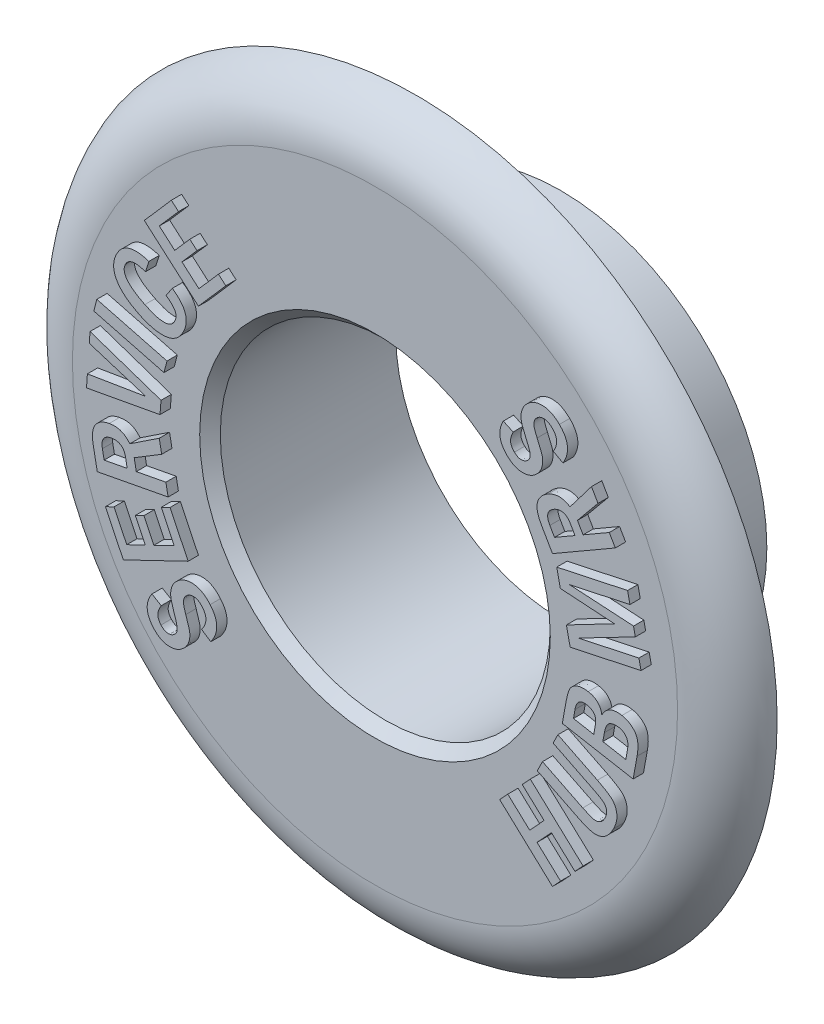
from build123d import *

# Parameters (mm, degrees)
ESQUISSE1_R        = 10
ESQUISSE1_R_2      = 8
BOSS_EXTRU_1_DEPTH = 7
ESQUISSE2_R        = 17.5
ESQUISSE2_R_2      = 8
BOSS_EXTRU_2_DEPTH = 2
CONG_1_R           = 3
CHANFREIN1_SIZE    = 0.5
BOSS_EXTRU_3_DEPTH = 0.5


with BuildPart() as part:
    # Esquisse1 → Boss.-Extru.1 (new body)
    with BuildSketch(Plane.XY):
        Circle(ESQUISSE1_R)
        Circle(ESQUISSE1_R_2, mode=Mode.SUBTRACT)
    extrude(amount=BOSS_EXTRU_1_DEPTH)

    # Esquisse2 → Boss.-Extru.2 (add)
    with BuildSketch(Plane.XY.offset(7)):
        Circle(ESQUISSE2_R)
        Circle(ESQUISSE2_R_2, mode=Mode.SUBTRACT)
    extrude(amount=BOSS_EXTRU_2_DEPTH)

    # Congé1
    # the kernel refuses this fillet: 3 mm, written as the material it takes off along each edge
    with BuildSketch(Plane(origin=(0, 0, 9), x_dir=(1, 0, 0), z_dir=(0, -1, 0))) as cong_1_piece_1:
        with BuildLine():
            CenterArc((14.671572875, -3), CONG_1_R, 19.471220634, 70.528779366)
            Line((14.671572875, 0), (14.671572875, 0.06))
            Line((14.671572875, 0.06), (17.5, 0.06))
            Line((17.5, 0.06), (17.56, 0))
            ThreePointArc((17.56, 0), (17.56, -1), (17.556568542, -1.98))
            Line((17.556568542, -1.98), (17.5, -2))
        make_face()
    revolve(axis=Axis((0, 0, 9), (0, 0, 1)), mode=Mode.SUBTRACT)

    # Chanfrein1
    chanfrein1_edges = [part.edges().sort_by_distance(p)[0] for p in [
        (-8, 0, 9),
    ]]
    chamfer(chanfrein1_edges, length=CHANFREIN1_SIZE)

    # Esquisse3 → Boss.-Extru.3 (add)
    # profile 1 of 13: a face of its own
    with BuildSketch(Plane.XY.offset(9)):
        Polygon((-10.68446492, 8.147242191), (-9.374243566, 9.650388892), (-9.026370302, 9.347328996), (-9.958336448, 8.278644101), (-9.208661969, 7.624672746), (-8.477976205, 8.462454864), (-8.127824295, 8.157116323), (-8.858510059, 7.319334205), (-8.037438011, 6.603079864), (-7.089521344, 7.689234378), (-6.734052594, 7.379338545), (-8.060224469, 5.858722226), align=None)
    # profile 2 of 13: a face of its own
    with BuildSketch(Plane.XY.offset(9)):
        with BuildLine():
            Line((-9.629167081, 5.527917033), (-9.327626283, 5.973772068))
            add(Edge.make_bspline(
                [(-9.327626283, 5.973772068), (-9.288523151, 5.946412466), (-9.212247057, 5.89304376), (-9.107112651, 5.807054021), (-9.011973374, 5.720329142), (-8.928285511, 5.631574205), (-8.855470707, 5.540730464), (-8.793890013, 5.44824142), (-8.742978381, 5.353996308), (-8.703537218, 5.257978965), (-8.673680199, 5.160228846), (-8.657805151, 5.060066664), (-8.65033756, 4.958597019), (-8.655158448, 4.855396274), (-8.671523419, 4.75090668), (-8.698381765, 4.644612685), (-8.736398456, 4.536602557), (-8.769261427, 4.465812838), (-8.786068123, 4.429609741)],
                knots=[0, 0, 0, 0, 1.25831485, 2.45451805, 3.579291553, 4.651643519, 5.668437617, 6.646312129, 7.578428866, 8.488641703, 9.380244482, 10.267259418, 11.157410686, 12.059775972, 12.985291658, 13.942449899, 14.947733, 16, 16, 16, 16], degree=3))
            add(Edge.make_bspline(
                [(-8.786068123, 4.429609741), (-8.81018458, 4.383990006), (-8.857164132, 4.295121447), (-8.941744596, 4.17424993), (-9.036572059, 4.070271564), (-9.140141608, 3.981492211), (-9.253338153, 3.90889875), (-9.375881609, 3.851979466), (-9.508024686, 3.81283806), (-9.647996102, 3.788642515), (-9.794917323, 3.780390366), (-9.9472984, 3.7844226), (-10.104714086, 3.80072544), (-10.266500887, 3.833417166), (-10.433894746, 3.875891862), (-10.605605251, 3.934902249), (-10.782820552, 4.005059515), (-10.900444854, 4.060799242), (-10.960655796, 4.089331964)],
                knots=[0, 0, 0, 0, 0.995387172, 1.939042868, 2.838471923, 3.705148016, 4.564615462, 5.426122934, 6.304269616, 7.216983654, 8.162005062, 9.139719801, 10.157035791, 11.212287137, 12.322937725, 13.488188407, 14.714223669, 16, 16, 16, 16], degree=3))
            add(Edge.make_bspline(
                [(-10.960655796, 4.089331964), (-11.024625405, 4.121729481), (-11.148771362, 4.184603414), (-11.322823813, 4.288936283), (-11.482513303, 4.394292836), (-11.624351326, 4.505474254), (-11.7511753, 4.619037692), (-11.861491547, 4.736510345), (-11.955839706, 4.857932349), (-12.033877365, 4.982722027), (-12.094992332, 5.110343035), (-12.138855826, 5.240145813), (-12.166254265, 5.371734131), (-12.174081114, 5.505409196), (-12.165597993, 5.64032507), (-12.140213385, 5.776841018), (-12.096589977, 5.914884746), (-12.055637119, 6.004551454), (-12.034657533, 6.050486477)],
                knots=[0, 0, 0, 0, 1.36088723, 2.641076774, 3.850211054, 4.990550643, 6.0591517, 7.079351571, 8.04558552, 8.973893925, 9.868283002, 10.725557099, 11.569234989, 12.412049838, 13.259661871, 14.12981556, 15.041930203, 16, 16, 16, 16], degree=3))
            add(Edge.make_bspline(
                [(-12.034657533, 6.050486477), (-12.01652265, 6.085263021), (-11.981137638, 6.153119455), (-11.918996908, 6.247158573), (-11.85151828, 6.331725909), (-11.778308094, 6.406645257), (-11.699608943, 6.471925409), (-11.614881406, 6.526813123), (-11.524337953, 6.571833383), (-11.428542262, 6.607954947), (-11.326671475, 6.632474705), (-11.219692835, 6.64879245), (-11.107049122, 6.654182251), (-10.988647643, 6.651516802), (-10.864875715, 6.636983963), (-10.735461796, 6.614242785), (-10.600506815, 6.581420565), (-10.509833527, 6.552834093), (-10.463151456, 6.538116686)],
                knots=[0, 0, 0, 0, 1.02887218, 2.007548468, 2.952992882, 3.864623913, 4.752053024, 5.631258426, 6.507948933, 7.401601169, 8.312214402, 9.252953045, 10.237881195, 11.268233043, 12.357988157, 13.505130795, 14.715546058, 16, 16, 16, 16], degree=3))
            Line((-10.463151456, 6.538116686), (-10.628733053, 6.020104533))
            add(Edge.make_bspline(
                [(-10.628733053, 6.020104533), (-10.659284304, 6.03073682), (-10.718742162, 6.051429033), (-10.806615965, 6.077366329), (-10.89059078, 6.097112446), (-10.97037151, 6.112045558), (-11.046299705, 6.12017085), (-11.117876374, 6.123762672), (-11.185223932, 6.120599536), (-11.248527079, 6.112348989), (-11.307993987, 6.098984017), (-11.363248167, 6.079315092), (-11.413439469, 6.05283468), (-11.460879665, 6.022610163), (-11.502895401, 5.985089734), (-11.541526442, 5.94273923), (-11.576123915, 5.894759269), (-11.594564513, 5.859089535), (-11.60399347, 5.840851061)],
                knots=[0, 0, 0, 0, 1.413799054, 2.751490137, 4.002320606, 5.183148462, 6.296449753, 7.337619889, 8.312456566, 9.238987682, 10.124841889, 10.971971393, 11.793562264, 12.600792888, 13.424244837, 14.246803994, 15.103564363, 16, 16, 16, 16], degree=3))
            add(Edge.make_bspline(
                [(-11.60399347, 5.840851061), (-11.615174608, 5.816079379), (-11.637111522, 5.767478402), (-11.655803847, 5.690905822), (-11.663107717, 5.614325479), (-11.657428003, 5.537974141), (-11.64041178, 5.461436327), (-11.611004664, 5.385097142), (-11.56960988, 5.308814069), (-11.515353809, 5.233214837), (-11.449787203, 5.157470957), (-11.372597091, 5.081285228), (-11.283002271, 5.005218028), (-11.181591009, 4.929215913), (-11.068422054, 4.852676526), (-10.942679842, 4.77732874), (-10.805745366, 4.700369443), (-10.708955482, 4.651999665), (-10.659114998, 4.62709238)],
                knots=[0, 0, 0, 0, 0.762739505, 1.496462176, 2.204065549, 2.917622913, 3.639510571, 4.400986876, 5.209955146, 6.073014985, 7.011856248, 8.023561265, 9.119133035, 10.313562916, 11.58498584, 12.958347195, 14.433746976, 16, 16, 16, 16], degree=3))
            add(Edge.make_bspline(
                [(-10.659114998, 4.62709238), (-10.612152376, 4.604789843), (-10.52113503, 4.561565728), (-10.386967021, 4.503360182), (-10.258935918, 4.455786848), (-10.138201985, 4.415335725), (-10.023635328, 4.385934168), (-9.915894253, 4.364839714), (-9.814793259, 4.353085173), (-9.720250628, 4.35084177), (-9.632254647, 4.356029984), (-9.550911717, 4.372301282), (-9.476025688, 4.396912023), (-9.40814468, 4.431844591), (-9.346433462, 4.475279497), (-9.29263992, 4.529257152), (-9.244493259, 4.59125456), (-9.219603038, 4.6380633), (-9.206858053, 4.662031616)],
                knots=[0, 0, 0, 0, 1.53911643, 2.98293173, 4.32778885, 5.58167492, 6.750622574, 7.826677445, 8.829887108, 9.75958998, 10.623645347, 11.433600667, 12.208678301, 12.949511569, 13.685780671, 14.433107302, 15.197675913, 16, 16, 16, 16], degree=3))
            add(Edge.make_bspline(
                [(-9.206858053, 4.662031616), (-9.197875835, 4.681879427), (-9.180438706, 4.720409868), (-9.16110149, 4.779360296), (-9.149506607, 4.837497929), (-9.145528884, 4.894712099), (-9.149521356, 4.950607241), (-9.160150064, 5.005307331), (-9.17846353, 5.058776824), (-9.214886129, 5.129861082), (-9.276884659, 5.218549592), (-9.372458475, 5.322651747), (-9.491234603, 5.427701806), (-9.581463575, 5.493257917), (-9.629167081, 5.527917033)],
                knots=[0, 0, 0, 0, 0.734552614, 1.425982771, 2.087600162, 2.729576946, 3.354511132, 3.972579313, 4.604593488, 5.253913844, 6.661062636, 8.239250348, 10.011714634, 12, 12, 12, 12], degree=3))
        make_face()
    # profile 3 of 13: a face of its own
    with BuildSketch(Plane.XY.offset(9)):
        Polygon((-13.133591563, 3.119179753), (-12.986998681, 3.682005274), (-9.584980452, 2.795612045), (-9.731573334, 2.232786524), align=None)
    # profile 4 of 13: a face of its own
    with BuildSketch(Plane.XY.offset(9)):
        Polygon((-13.487774917, -0.285368175), (-13.445240195, 0.32454936), (-10.607566584, 0.793190853), (-13.351815715, 1.655278526), (-13.316116931, 2.167973839), (-9.873842625, 0.999788075), (-9.925491931, 0.372400922), align=None)
    # profile 5 of 13: a face of its own
    with BuildSketch(Plane.XY.offset(9)):
        with BuildLine():
            Line((-12.965405852, -3.544240459), (-13.162128942, -2.5104948))
            add(Edge.make_bspline(
                [(-13.162128942, -2.5104948), (-13.17008957, -2.465013184), (-13.185462186, -2.377184512), (-13.197760614, -2.247949754), (-13.200024323, -2.12660272), (-13.194061619, -2.012602975), (-13.17631, -1.906555741), (-13.149844896, -1.807998756), (-13.114405164, -1.716492165), (-13.067588988, -1.633276534), (-13.011540857, -1.557876991), (-12.948086226, -1.488619313), (-12.875503261, -1.426717498), (-12.793638717, -1.373147109), (-12.704194849, -1.325678323), (-12.606213687, -1.285525798), (-12.499834641, -1.251767873), (-12.425028715, -1.236310979), (-12.38662981, -1.228376744)],
                knots=[0, 0, 0, 0, 1.290793418, 2.49262631, 3.625590054, 4.682399745, 5.679870009, 6.626179873, 7.532004329, 8.416325126, 9.287166724, 10.153941036, 11.037808278, 11.946946737, 12.8843961, 13.865220213, 14.904188337, 16, 16, 16, 16], degree=3))
            add(Edge.make_bspline(
                [(-12.38662981, -1.228376744), (-12.335364083, -1.22026901), (-12.236027982, -1.204558892), (-12.088933948, -1.202537929), (-11.950051897, -1.217857883), (-11.819456852, -1.252807835), (-11.697879044, -1.307937076), (-11.58437868, -1.380582285), (-11.479849702, -1.47305104), (-11.419542924, -1.545759331), (-11.388582935, -1.583085945)],
                knots=[0, 0, 0, 0, 1.10925397, 2.149368998, 3.136351053, 4.090288788, 5.028550404, 5.981149299, 6.963572659, 8, 8, 8, 8], degree=3))
            Line((-11.388582935, -1.583085945), (-9.960631547, -0.635169279))
            Line((-9.960631547, -0.635169279), (-9.842901512, -1.251922751))
            Line((-9.842901512, -1.251922751), (-11.174390227, -2.060842022))
            Line((-11.174390227, -2.060842022), (-11.073370262, -2.594045147))
            Line((-11.073370262, -2.594045147), (-9.639342484, -2.320607647))
            Line((-9.639342484, -2.320607647), (-9.530727033, -2.889509557))
            Line((-9.530727033, -2.889509557), (-12.965405852, -3.544240459))
        make_face()
        with BuildLine():
            Line((-12.633483109, -2.891028654), (-11.513908456, -2.677595494))
            Line((-11.513908456, -2.677595494), (-11.596699255, -2.24237414))
            add(Edge.make_bspline(
                [(-11.596699255, -2.24237414), (-11.60168705, -2.219003108), (-11.611373057, -2.173617924), (-11.630882925, -2.108868857), (-11.655294572, -2.050216025), (-11.683432073, -1.997047911), (-11.716129362, -1.949943556), (-11.752724351, -1.90818378), (-11.794288414, -1.873190408), (-11.854086854, -1.833608608), (-11.937611993, -1.797561564), (-12.046234501, -1.77311482), (-12.164176856, -1.768518469), (-12.243955168, -1.780926114), (-12.285609845, -1.787404522)],
                knots=[0, 0, 0, 0, 0.914520806, 1.775946179, 2.584041781, 3.342806041, 4.074024624, 4.774208137, 5.461667363, 6.147074263, 7.513839802, 8.915044919, 10.389251365, 12, 12, 12, 12], degree=3))
            add(Edge.make_bspline(
                [(-12.285609845, -1.787404522), (-12.30720935, -1.791885773), (-12.349284331, -1.800615074), (-12.409298565, -1.818800401), (-12.464099077, -1.840876791), (-12.514077707, -1.866013391), (-12.559154408, -1.894722795), (-12.598946, -1.927856423), (-12.634135785, -1.963922386), (-12.663088889, -2.004581586), (-12.68882559, -2.047515902), (-12.707199177, -2.095255634), (-12.722152535, -2.14570938), (-12.73078397, -2.200070364), (-12.735515075, -2.257975203), (-12.734525427, -2.319487234), (-12.728254543, -2.384434041), (-12.720853602, -2.428502949), (-12.717033456, -2.451250008)],
                knots=[0, 0, 0, 0, 1.165356172, 2.270067758, 3.308625834, 4.283981557, 5.222959475, 6.125779299, 7.015315027, 7.877045866, 8.758291616, 9.652744439, 10.571680299, 11.535124667, 12.555159645, 13.639012621, 14.78132856, 16, 16, 16, 16], degree=3))
            Line((-12.717033456, -2.451250008), (-12.633483109, -2.891028654))
        make_face(mode=Mode.SUBTRACT)
    # profile 6 of 13: a face of its own
    with BuildSketch(Plane.XY.offset(9)):
        Polygon((-11.702584446, -6.614832221), (-12.569229411, -4.813942464), (-12.152237224, -4.613421631), (-11.5362433, -5.894020589), (-10.638456842, -5.46183743), (-11.121529758, -4.457714166), (-10.702258925, -4.255674235), (-10.219186008, -5.259797499), (-9.236330106, -4.786598714), (-9.862198161, -3.485491943), (-9.43609139, -3.280413818), (-8.559572293, -5.101811388), align=None)
    # profile 7 of 13: a face of its own
    with BuildSketch(Plane.XY.offset(9)):
        with BuildLine():
            Line((-10.314825514, -7.352409652), (-9.864413188, -7.618251666))
            add(Edge.make_bspline(
                [(-9.864413188, -7.618251666), (-9.887816073, -7.657535695), (-9.932180437, -7.732005612), (-9.98211838, -7.845457071), (-10.015106839, -7.952158308), (-10.030326203, -8.054042303), (-10.024278486, -8.153295863), (-9.995873138, -8.250434551), (-9.945800643, -8.346320416), (-9.899882194, -8.404842111), (-9.875806417, -8.435525972)],
                knots=[0, 0, 0, 0, 1.232774222, 2.336944519, 3.335370675, 4.238619663, 5.101039672, 5.996167596, 6.949358623, 8, 8, 8, 8], degree=3))
            add(Edge.make_bspline(
                [(-9.875806417, -8.435525972), (-9.851422806, -8.461870093), (-9.804848098, -8.512189534), (-9.722775909, -8.568669112), (-9.636474502, -8.60539575), (-9.546890271, -8.61921404), (-9.458986529, -8.615303045), (-9.375733095, -8.59597163), (-9.297762077, -8.562869341), (-9.253354714, -8.528713599), (-9.230949646, -8.511480833)],
                knots=[0, 0, 0, 0, 1.183094996, 2.259808946, 3.264987231, 4.256601532, 5.227929008, 6.15532004, 7.069294426, 8, 8, 8, 8], degree=3))
            add(Edge.make_bspline(
                [(-9.230949646, -8.511480833), (-9.20857995, -8.490658342), (-9.165242752, -8.450318572), (-9.119788487, -8.375284532), (-9.092645751, -8.293731407), (-9.088068083, -8.220297168), (-9.092349629, -8.156334771), (-9.10023612, -8.100042488), (-9.112597308, -8.036215466), (-9.129334223, -7.965019173), (-9.151010506, -7.886354094), (-9.176646486, -7.800190078), (-9.207228603, -7.706549085), (-9.229814254, -7.642008665), (-9.241583327, -7.608377534)],
                knots=[0, 0, 0, 0, 1.132970691, 2.194923599, 3.226112079, 4.303839073, 4.908178949, 5.611925179, 6.417809656, 7.327644688, 8.333588555, 9.454738265, 10.673698924, 12, 12, 12, 12], degree=3))
            add(Edge.make_bspline(
                [(-9.241583327, -7.608377534), (-9.261397566, -7.551594778), (-9.298849392, -7.444267017), (-9.34324679, -7.289326809), (-9.378372114, -7.151839301), (-9.40114553, -7.027840982), (-9.410306258, -6.911728672), (-9.40493781, -6.798444242), (-9.385372944, -6.685337001), (-9.353087411, -6.573087079), (-9.305663894, -6.463352024), (-9.240275023, -6.360207354), (-9.161496475, -6.261650147), (-9.097892162, -6.204389552), (-9.065368049, -6.175109305)],
                knots=[0, 0, 0, 0, 1.388615614, 2.624687759, 3.720901215, 4.664891461, 5.532645414, 6.404820446, 7.276681831, 8.177833469, 9.096866396, 10.026551273, 10.990875536, 12, 12, 12, 12], degree=3))
            add(Edge.make_bspline(
                [(-9.065368049, -6.175109305), (-9.037451177, -6.152479592), (-8.982283285, -6.107759914), (-8.892800977, -6.051894722), (-8.800797359, -6.004836639), (-8.704984363, -5.96942045), (-8.606784256, -5.942266848), (-8.505113887, -5.926274739), (-8.400290044, -5.921626442), (-8.293181811, -5.924768171), (-8.185128749, -5.939996362), (-8.078574494, -5.967323269), (-7.974470134, -6.007321049), (-7.873022908, -6.059453709), (-7.773628273, -6.123626201), (-7.677548901, -6.20106965), (-7.582577405, -6.28922844), (-7.523952875, -6.355358605), (-7.493861973, -6.389302013)],
                knots=[0, 0, 0, 0, 0.967342925, 1.911613474, 2.835890215, 3.746781221, 4.658489078, 5.576908237, 6.512591293, 7.48176012, 8.459888433, 9.445880936, 10.439019768, 11.457895025, 12.513616084, 13.620411782, 14.778600733, 16, 16, 16, 16], degree=3))
            add(Edge.make_bspline(
                [(-7.493861973, -6.389302013), (-7.468810606, -6.41955996), (-7.419832022, -6.478718065), (-7.356135225, -6.572042635), (-7.300920305, -6.665377035), (-7.255968039, -6.75970882), (-7.220802787, -6.854566372), (-7.194527787, -6.949787607), (-7.178685325, -7.046042068), (-7.17190711, -7.142651825), (-7.173711159, -7.239917915), (-7.187311547, -7.337494605), (-7.209466277, -7.435795423), (-7.24051891, -7.534819655), (-7.282218044, -7.633810995), (-7.332501799, -7.733661739), (-7.392599081, -7.834249752), (-7.438960544, -7.899344284), (-7.46272048, -7.932704791)],
                knots=[0, 0, 0, 0, 1.113883725, 2.177783286, 3.201475387, 4.187797156, 5.137750011, 6.068196147, 6.985688545, 7.900167732, 8.812613736, 9.740060933, 10.68974221, 11.668819236, 12.679910399, 13.73350413, 14.838436184, 16, 16, 16, 16], degree=3))
            Line((-7.46272048, -7.932704791), (-7.907815966, -7.633442638))
            add(Edge.make_bspline(
                [(-7.907815966, -7.633442638), (-7.891933411, -7.612060279), (-7.860893692, -7.570272136), (-7.818507055, -7.506699105), (-7.784252759, -7.442575495), (-7.753509855, -7.380326575), (-7.731254702, -7.317644948), (-7.713269182, -7.256129529), (-7.701925325, -7.1950793), (-7.696131896, -7.134780537), (-7.698188473, -7.075241589), (-7.704689122, -7.016423017), (-7.717920992, -6.958182594), (-7.73693856, -6.900438015), (-7.761962677, -6.84336387), (-7.793809143, -6.78753377), (-7.830777343, -6.731895365), (-7.859646956, -6.69668054), (-7.874395827, -6.678690034)],
                knots=[0, 0, 0, 0, 1.216945066, 2.378309676, 3.486077645, 4.53637461, 5.546344029, 6.520301286, 7.461778301, 8.379143167, 9.281657489, 10.178371626, 11.079179519, 12.004603382, 12.952383183, 13.92083003, 14.937796249, 16, 16, 16, 16], degree=3))
            add(Edge.make_bspline(
                [(-7.874395827, -6.678690034), (-7.889289547, -6.66169564), (-7.918123569, -6.628794742), (-7.965141132, -6.585390035), (-8.011971784, -6.547430596), (-8.059216929, -6.514707159), (-8.108162517, -6.489644892), (-8.157706903, -6.4708751), (-8.207595189, -6.456291881), (-8.274404362, -6.448096872), (-8.356910399, -6.449274215), (-8.452994548, -6.468515254), (-8.543176157, -6.510240632), (-8.596144827, -6.550292707), (-8.623310757, -6.570834131)],
                knots=[0, 0, 0, 0, 0.953603482, 1.846162269, 2.697696338, 3.498312667, 4.268142649, 5.012688264, 5.733759895, 6.456493986, 7.846495211, 9.201013947, 10.564489874, 12, 12, 12, 12], degree=3))
            add(Edge.make_bspline(
                [(-8.623310757, -6.570834131), (-8.642227093, -6.588436584), (-8.679802587, -6.623402176), (-8.723956808, -6.686967659), (-8.757656982, -6.757512736), (-8.778223687, -6.82212742), (-8.78634872, -6.880770979), (-8.786495183, -6.932725147), (-8.781966911, -6.991951931), (-8.770576624, -7.058542415), (-8.754680173, -7.132550253), (-8.733388858, -7.213980756), (-8.705489198, -7.302409415), (-8.684469845, -7.363598133), (-8.673440966, -7.395703923)],
                knots=[0, 0, 0, 0, 1.045037225, 2.07586664, 3.11326597, 4.207396121, 4.808299537, 5.506274967, 6.309172229, 7.213560656, 8.242190775, 9.377334243, 10.623884286, 12, 12, 12, 12], degree=3))
            add(Edge.make_bspline(
                [(-8.673440966, -7.395703923), (-8.661511182, -7.429873016), (-8.638470506, -7.495865751), (-8.605651771, -7.591434738), (-8.576623504, -7.680516528), (-8.551554449, -7.763074097), (-8.530314796, -7.839374959), (-8.511900359, -7.908904337), (-8.497376291, -7.971970267), (-8.482881135, -8.047365792), (-8.472271981, -8.139275482), (-8.477108476, -8.251092331), (-8.494627979, -8.366100545), (-8.526946847, -8.482596142), (-8.574644494, -8.597165987), (-8.637806024, -8.706390496), (-8.719536018, -8.806588717), (-8.783576229, -8.865677655), (-8.816236105, -8.89581243)],
                knots=[0, 0, 0, 0, 1.065855494, 2.058548027, 2.975790485, 3.824954578, 4.599258703, 5.308192774, 5.943071298, 6.504622996, 7.569304222, 8.658557854, 9.790069877, 10.989440537, 12.209401177, 13.435793292, 14.6922799, 16, 16, 16, 16], degree=3))
            add(Edge.make_bspline(
                [(-8.816236105, -8.89581243), (-8.842658339, -8.917382506), (-8.894669673, -8.959842519), (-8.978842374, -9.013153342), (-9.06562799, -9.056220358), (-9.154562823, -9.091423771), (-9.246725144, -9.115218043), (-9.34153454, -9.130836935), (-9.439061314, -9.135949598), (-9.538250482, -9.131263323), (-9.637414363, -9.117319079), (-9.734501814, -9.091685536), (-9.828814124, -9.056950524), (-9.920100645, -9.011450221), (-10.008531444, -8.955892231), (-10.093490084, -8.888934168), (-10.177039283, -8.813416376), (-10.227525394, -8.75583328), (-10.253302077, -8.72643309)],
                knots=[0, 0, 0, 0, 1.008097408, 1.984407887, 2.938792323, 3.87046422, 4.807656473, 5.748163271, 6.708054267, 7.690005311, 8.681191697, 9.663742108, 10.654079609, 11.64865429, 12.67494191, 13.736886648, 14.844522675, 16, 16, 16, 16], degree=3))
            add(Edge.make_bspline(
                [(-10.253302077, -8.72643309), (-10.275196967, -8.699628308), (-10.318159163, -8.647031911), (-10.374887171, -8.564964266), (-10.424363983, -8.482581764), (-10.464212475, -8.398876261), (-10.497519743, -8.315096117), (-10.521889503, -8.230388693), (-10.538052644, -8.14494252), (-10.545376201, -8.05895276), (-10.545653505, -7.972509035), (-10.537047938, -7.885287073), (-10.520283223, -7.797657561), (-10.495628623, -7.709254028), (-10.462817289, -7.620380642), (-10.421722535, -7.530737948), (-10.372046349, -7.440872429), (-10.334171653, -7.382318567), (-10.314825514, -7.352409652)],
                knots=[0, 0, 0, 0, 1.108987317, 2.176057143, 3.194850275, 4.185755594, 5.144227614, 6.081718795, 7.006478461, 7.927098242, 8.844134159, 9.773582296, 10.73174506, 11.70046914, 12.712061313, 13.765183945, 14.858471117, 16, 16, 16, 16], degree=3))
        make_face()
    # profile 8 of 13: a face of its own
    with BuildSketch(Plane.XY.offset(9)):
        with BuildLine():
            Line((9.582545549, -2.839003623), (9.769394508, -1.799941123))
            add(Edge.make_bspline(
                [(9.769394508, -1.799941123), (9.775322491, -1.768263173), (9.786822545, -1.7068092), (9.805977434, -1.617960404), (9.825132764, -1.535166469), (9.847021061, -1.459234437), (9.86767234, -1.388965964), (9.89065745, -1.32523928), (9.913940323, -1.267584739), (9.946034212, -1.199073395), (9.996408205, -1.121895143), (10.075083374, -1.041669705), (10.171265762, -0.973042896), (10.283817588, -0.917454787), (10.409218354, -0.876222448), (10.545323788, -0.855446415), (10.689896362, -0.853642395), (10.787562866, -0.868095046), (10.838079403, -0.875570464)],
                knots=[0, 0, 0, 0, 0.945251826, 1.833751188, 2.665935571, 3.437134741, 4.151302968, 4.813708576, 5.423259351, 5.974664238, 7.031324814, 8.107943656, 9.251821701, 10.480656032, 11.777020425, 13.107833483, 14.504070144, 16, 16, 16, 16], degree=3))
            add(Edge.make_bspline(
                [(10.838079403, -0.875570464), (10.883496131, -0.88520571), (10.970918446, -0.903752524), (11.092335884, -0.950934778), (11.199387301, -1.010563778), (11.290564628, -1.08574418), (11.367258956, -1.174252446), (11.427117628, -1.277548221), (11.473139661, -1.394023378), (11.489597496, -1.477778676), (11.498127146, -1.521186783)],
                knots=[0, 0, 0, 0, 1.119188445, 2.154317361, 3.131474543, 4.065056187, 4.992475773, 5.943185146, 6.934008464, 8, 8, 8, 8], degree=3))
            add(Edge.make_bspline(
                [(11.498127146, -1.521186783), (11.510941804, -1.497683313), (11.536099445, -1.451541474), (11.579085468, -1.38723196), (11.623446525, -1.327217173), (11.672520224, -1.274287468), (11.723437494, -1.226213617), (11.776921842, -1.182969659), (11.833970188, -1.146156756), (11.893346147, -1.11367092), (11.956145054, -1.08798178), (12.02147132, -1.067500411), (12.089796898, -1.05218722), (12.160915917, -1.042276323), (12.234858518, -1.038759657), (12.311477787, -1.040417832), (12.390926358, -1.047074462), (12.444571593, -1.055734299), (12.471868466, -1.060140776)],
                knots=[0, 0, 0, 0, 1.100362842, 2.160224182, 3.178559253, 4.166140734, 5.12373614, 6.05713696, 6.989956837, 7.912374713, 8.836671243, 9.775226613, 10.725034944, 11.713110312, 12.724447902, 13.765889823, 14.863194041, 16, 16, 16, 16], degree=3))
            add(Edge.make_bspline(
                [(12.471868466, -1.060140776), (12.502909626, -1.066374546), (12.564435238, -1.078730287), (12.653043203, -1.107590754), (12.738064308, -1.141356641), (12.818247341, -1.18336679), (12.893248298, -1.233150561), (12.964799784, -1.28858409), (13.03052824, -1.352496546), (13.094025396, -1.42165727), (13.148704759, -1.502464623), (13.192336132, -1.595336454), (13.222659489, -1.700783245), (13.24345871, -1.81786036), (13.250534107, -1.947202756), (13.248394795, -2.088634703), (13.233273622, -2.242104764), (13.216070495, -2.34791783), (13.207111521, -2.40302272)],
                knots=[0, 0, 0, 0, 0.867820331, 1.720076762, 2.551940233, 3.375177085, 4.197710515, 5.018835295, 5.853939655, 6.709867066, 7.590186971, 8.519135842, 9.512328034, 10.591367383, 11.774525608, 13.059562109, 14.468690939, 16, 16, 16, 16], degree=3))
            Line((13.207111521, -2.40302272), (13.017224369, -3.457276193))
            Line((13.017224369, -3.457276193), (9.582545549, -2.839003623))
        make_face()
        with BuildLine():
            Line((11.106959612, -2.53974147), (11.171521244, -2.179715429))
            add(Edge.make_bspline(
                [(11.171521244, -2.179715429), (11.176697742, -2.14938715), (11.186626754, -2.091214657), (11.195069359, -2.006969664), (11.197414839, -1.930068494), (11.194853403, -1.860418137), (11.186130244, -1.797895885), (11.170938348, -1.742801329), (11.150667143, -1.694499267), (11.114503047, -1.640902636), (11.058411516, -1.584693695), (10.978546234, -1.53045792), (10.885229854, -1.490787337), (10.817631815, -1.475785638), (10.782632355, -1.46801838)],
                knots=[0, 0, 0, 0, 1.180910116, 2.265096755, 3.247233192, 4.132592379, 4.938108239, 5.66443435, 6.321728177, 6.939071705, 8.135046123, 9.34550726, 10.625613766, 12, 12, 12, 12], degree=3))
            add(Edge.make_bspline(
                [(10.782632355, -1.46801838), (10.761662767, -1.46463843), (10.721399103, -1.458148595), (10.662158392, -1.454209702), (10.606773949, -1.455857649), (10.554984904, -1.461398014), (10.507088145, -1.47309429), (10.46288898, -1.489381414), (10.422981016, -1.512169991), (10.385987598, -1.53859023), (10.352881861, -1.571450478), (10.322791608, -1.609321539), (10.295284182, -1.652448642), (10.270115375, -1.700716914), (10.247450766, -1.754546233), (10.227947273, -1.813785685), (10.211109748, -1.878256362), (10.202338169, -1.923185895), (10.197779924, -1.946534005)],
                knots=[0, 0, 0, 0, 1.167609834, 2.241925356, 3.258673122, 4.21195478, 5.100074023, 5.963738321, 6.792702101, 7.619793042, 8.456669626, 9.348165554, 10.275053664, 11.265239815, 12.338381862, 13.483105849, 14.692069123, 16, 16, 16, 16], degree=3))
            Line((10.197779924, -1.946534005), (10.12334416, -2.362007095))
            Line((10.12334416, -2.362007095), (11.106959612, -2.53974147))
        make_face(mode=Mode.SUBTRACT)
        with BuildLine():
            Line((12.661755619, -2.819255359), (12.743786869, -2.361247547))
            add(Edge.make_bspline(
                [(12.743786869, -2.361247547), (12.747955559, -2.335721565), (12.756016482, -2.286362423), (12.761694445, -2.21375567), (12.764042887, -2.145209787), (12.759035434, -2.080714161), (12.750413989, -2.020355014), (12.735854888, -1.964321585), (12.716058028, -1.912321935), (12.691088245, -1.864195958), (12.66024077, -1.820443814), (12.62426561, -1.780671764), (12.583185968, -1.745017489), (12.53714992, -1.713497238), (12.485512958, -1.686805087), (12.428624909, -1.664496463), (12.366819374, -1.644970845), (12.323355572, -1.636462835), (12.300970028, -1.63208088)],
                knots=[0, 0, 0, 0, 1.269316076, 2.454454208, 3.573532925, 4.632808939, 5.62613395, 6.563840724, 7.468841299, 8.352939145, 9.218578538, 10.089911819, 10.979845933, 11.88322288, 12.822905162, 13.82706114, 14.88085224, 16, 16, 16, 16], degree=3))
            add(Edge.make_bspline(
                [(12.300970028, -1.63208088), (12.265343935, -1.627303483), (12.195197549, -1.617896975), (12.089089146, -1.62526848), (11.986342372, -1.651066708), (11.90350243, -1.685905167), (11.840220109, -1.725098681), (11.797758024, -1.766933058), (11.757647325, -1.816395766), (11.723152808, -1.876860907), (11.691380445, -1.945968491), (11.663195045, -2.024685785), (11.640095815, -2.113293399), (11.627674032, -2.175846032), (11.621174021, -2.208578276)],
                knots=[0, 0, 0, 0, 1.264406386, 2.489566779, 3.721047904, 4.984162584, 5.642572449, 6.330611678, 7.073412802, 7.881473896, 8.775833638, 9.752462209, 10.823919145, 12, 12, 12, 12], degree=3))
            Line((11.621174021, -2.208578276), (11.547497806, -2.618734526))
            Line((11.547497806, -2.618734526), (12.661755619, -2.819255359))
        make_face(mode=Mode.SUBTRACT)
    # profile 9 of 13: a face of its own
    with BuildSketch(Plane.XY.offset(9)):
        with BuildLine():
            Line((8.369226136, -5.433141747), (8.622155824, -4.924244178))
            Line((8.622155824, -4.924244178), (10.572676657, -5.892668657))
            add(Edge.make_bspline(
                [(10.572676657, -5.892668657), (10.598962699, -5.905673514), (10.64981626, -5.930833), (10.724259041, -5.96579501), (10.793950941, -5.996821037), (10.858691258, -6.024375007), (10.918654938, -6.04812686), (10.974095834, -6.067465982), (11.024132406, -6.084895573), (11.084147816, -6.100760517), (11.155169869, -6.113303661), (11.238829601, -6.111529016), (11.319991174, -6.095489079), (11.39836571, -6.063758283), (11.472989139, -6.016391006), (11.540235686, -5.950422596), (11.602325934, -5.869535321), (11.635447881, -5.80690481), (11.652754782, -5.774179074)],
                knots=[0, 0, 0, 0, 1.11257379, 2.152409961, 3.119856868, 4.006494984, 4.821626478, 5.565942933, 6.234169589, 6.830613525, 7.920187297, 8.957714101, 9.986220702, 11.042124719, 12.147877941, 13.316386701, 14.597756592, 16, 16, 16, 16], degree=3))
            add(Edge.make_bspline(
                [(11.652754782, -5.774179074), (11.667530774, -5.742618798), (11.695535134, -5.682803843), (11.722404778, -5.59223278), (11.735481384, -5.508059948), (11.733690997, -5.429428825), (11.716817455, -5.356703721), (11.689520899, -5.288120123), (11.648975978, -5.224158434), (11.605138271, -5.174744304), (11.562207534, -5.134246072), (11.519344806, -5.102395233), (11.468012812, -5.067024906), (11.407287356, -5.029706455), (11.338236682, -4.988357535), (11.259494244, -4.945197381), (11.171897025, -4.899076984), (11.1099922, -4.868170839), (11.077776484, -4.85208706)],
                knots=[0, 0, 0, 0, 1.318552033, 2.499000043, 3.565089949, 4.534188072, 5.457947024, 6.378713874, 7.318073962, 8.310524937, 8.873775298, 9.550929321, 10.330384761, 11.235179121, 12.250038152, 13.379067315, 14.636047812, 16, 16, 16, 16], degree=3))
            Line((11.077776484, -4.85208706), (9.136370234, -3.888219872))
            Line((9.136370234, -3.888219872), (9.36803256, -3.421097476))
            Line((9.36803256, -3.421097476), (11.283614157, -4.372052338))
            add(Edge.make_bspline(
                [(11.283614157, -4.372052338), (11.320958095, -4.390545284), (11.393326549, -4.426382586), (11.496642288, -4.482549174), (11.593236702, -4.535668726), (11.681387009, -4.589446016), (11.762553013, -4.640525759), (11.835939529, -4.690738798), (11.901150559, -4.740135859), (11.960027012, -4.788386408), (12.012659301, -4.837918434), (12.058488981, -4.891972071), (12.09976209, -4.949320001), (12.134407577, -5.011629623), (12.16555128, -5.076958136), (12.189100812, -5.147336008), (12.209513696, -5.22119443), (12.222669582, -5.299314422), (12.230666944, -5.380538118), (12.230461582, -5.46446469), (12.222594719, -5.550809309), (12.207606076, -5.63983478), (12.183166981, -5.731119289), (12.153242721, -5.825563341), (12.114050385, -5.921889118), (12.08373016, -5.985983305), (12.068227872, -6.018753726)],
                knots=[0, 0, 0, 0, 1.408901263, 2.730296061, 3.975890233, 5.135749142, 6.221086147, 7.218414266, 8.141278657, 8.98637663, 9.791686897, 10.580956907, 11.379091248, 12.176536611, 12.988508253, 13.822388097, 14.682102276, 15.577231657, 16.49723272, 17.438924595, 18.410079569, 19.426225829, 20.487251479, 21.60265965, 22.77427493, 24, 24, 24, 24], degree=3))
            add(Edge.make_bspline(
                [(12.068227872, -6.018753726), (12.042068441, -6.068409227), (11.991511102, -6.164376525), (11.902323263, -6.295894071), (11.805429562, -6.410560461), (11.717584289, -6.493972041), (11.643047389, -6.549932909), (11.585944551, -6.587284065), (11.525527067, -6.616910241), (11.463853641, -6.643712615), (11.399211952, -6.662869907), (11.332726818, -6.677599276), (11.264114137, -6.686489506), (11.191981672, -6.690837949), (11.113798689, -6.686693764), (11.027731692, -6.67315052), (10.932264378, -6.650872338), (10.827914772, -6.618213443), (10.713559474, -6.578270439), (10.590776755, -6.527112925), (10.457526983, -6.469273124), (10.366911457, -6.424743471), (10.31974697, -6.401566226)],
                knots=[0, 0, 0, 0, 1.609503038, 3.110625363, 4.548686431, 5.910753836, 6.574748575, 7.221632877, 7.864917441, 8.503095183, 9.148836291, 9.795761383, 10.455370113, 11.131962508, 11.866595279, 12.696743679, 13.628948745, 14.676879467, 15.8326055, 17.103408164, 18.492352551, 20, 20, 20, 20], degree=3))
            Line((10.31974697, -6.401566226), (8.369226136, -5.433141747))
        make_face()
    # profile 10 of 13: a face of its own
    with BuildSketch(Plane.XY.offset(9)):
        Polygon((6.545129262, -7.554482748), (6.937815894, -7.130654623), (7.998905304, -8.113510526), (8.697690026, -7.359278755), (7.636600616, -6.376422853), (8.029287248, -5.952594728), (10.588966068, -8.323145943), (10.196279436, -8.746974068), (9.05619697, -7.691201498), (8.357412248, -8.445433269), (9.497494713, -9.501205839), (9.104808081, -9.925033964), align=None)
    # profile 11 of 13: a face of its own
    with BuildSketch(Plane.XY.offset(9)):
        Polygon((9.96276153, 0.55165299), (9.78198896, 1.394751949), (12.111524551, 2.610029726), (9.485005453, 2.780928164), (9.31182837, 3.589087886), (12.746507189, 4.32509049), (12.860439481, 3.791127817), (9.929341391, 3.162981115), (13.035135662, 2.976132157), (13.124002849, 2.563697261), (10.361524551, 1.134226775), (13.294901287, 1.763133025), (13.397440349, 1.287655594), align=None)
    # profile 12 of 13: a face of its own
    with BuildSketch(Plane.XY.offset(9)):
        with BuildLine():
            Line((9.105546407, 4.053155922), (8.576141025, 4.969931095))
            add(Edge.make_bspline(
                [(8.576141025, 4.969931095), (8.553502545, 5.010378652), (8.509661257, 5.088708692), (8.456002594, 5.207570419), (8.412824303, 5.32185343), (8.381142595, 5.432254525), (8.36176904, 5.538878527), (8.35478217, 5.641557078), (8.359085708, 5.739977848), (8.375071439, 5.834419771), (8.402717608, 5.924650515), (8.441126007, 6.010849546), (8.489376785, 6.09391834), (8.548654148, 6.172311145), (8.618123335, 6.247138677), (8.698163809, 6.317263492), (8.788066469, 6.384768208), (8.853762425, 6.424524266), (8.887555955, 6.444974498)],
                knots=[0, 0, 0, 0, 1.288006234, 2.494330636, 3.621231009, 4.681779934, 5.682712124, 6.627953108, 7.536859915, 8.415082694, 9.283378528, 10.153070956, 11.033068693, 11.948032138, 12.879335268, 13.866538856, 14.902562828, 16, 16, 16, 16], degree=3))
            add(Edge.make_bspline(
                [(8.887555955, 6.444974498), (8.933621849, 6.469602086), (9.022812099, 6.517284667), (9.161464056, 6.569105361), (9.298838842, 6.598939289), (9.434487707, 6.609818058), (9.56843308, 6.597643166), (9.700625013, 6.566298004), (9.830852721, 6.513407153), (9.912299691, 6.46411334), (9.953962205, 6.438898109)],
                knots=[0, 0, 0, 0, 1.10923941, 2.147648352, 3.133313039, 4.088188583, 5.027830365, 5.979167605, 6.966284961, 8, 8, 8, 8], degree=3))
            Line((9.953962205, 6.438898109), (10.996822448, 7.81140245))
            Line((10.996822448, 7.81140245), (11.312035122, 7.26452745))
            Line((11.312035122, 7.26452745), (10.315507344, 6.054566512))
            Line((10.315507344, 6.054566512), (10.588185295, 5.582127276))
            Line((10.588185295, 5.582127276), (11.85966967, 6.316610783))
            Line((11.85966967, 6.316610783), (12.151336337, 5.812270505))
            Line((12.151336337, 5.812270505), (9.105546407, 4.053155922))
        make_face()
        with BuildLine():
            Line((9.204287726, 4.783082137), (10.197777309, 5.356541338))
            Line((10.197777309, 5.356541338), (9.975229566, 5.742392033))
            add(Edge.make_bspline(
                [(9.975229566, 5.742392033), (9.962660795, 5.763125861), (9.938457932, 5.803051641), (9.897617271, 5.857571942), (9.855251737, 5.905399561), (9.811276129, 5.947052587), (9.764439075, 5.980877673), (9.715463434, 6.007289954), (9.665114157, 6.028697029), (9.594896998, 6.045008691), (9.503847978, 6.053147427), (9.392329801, 6.039115326), (9.278668121, 6.004437583), (9.206766832, 5.966469619), (9.16934849, 5.946710609)],
                knots=[0, 0, 0, 0, 0.921517866, 1.774506892, 2.586010878, 3.348947457, 4.073052721, 4.775324547, 5.46184597, 6.146000655, 7.508370048, 8.913903209, 10.393956085, 12, 12, 12, 12], degree=3))
            add(Edge.make_bspline(
                [(9.16934849, 5.946710609), (9.15023247, 5.935017774), (9.113315774, 5.912436671), (9.061786438, 5.876293839), (9.017387062, 5.836691921), (8.978096045, 5.796426118), (8.944635201, 5.754100043), (8.918028391, 5.709514615), (8.896469307, 5.663622489), (8.882085875, 5.615435408), (8.872771311, 5.566059803), (8.869824942, 5.514771168), (8.873053979, 5.461796408), (8.882221842, 5.407058305), (8.897890779, 5.350830939), (8.91815559, 5.292602463), (8.94615226, 5.233403753), (8.967618321, 5.193891364), (8.978701789, 5.173490123)],
                knots=[0, 0, 0, 0, 1.177287283, 2.273567245, 3.300863945, 4.298010118, 5.22662028, 6.127671954, 7.020438826, 7.882967753, 8.762155631, 9.654922503, 10.574245851, 11.545141997, 12.564746072, 13.637535091, 14.780199893, 16, 16, 16, 16], degree=3))
            Line((8.978701789, 5.173490123), (9.204287726, 4.783082137))
        make_face(mode=Mode.SUBTRACT)
    # profile 13 of 13: a face of its own
    with BuildSketch(Plane.XY.offset(9)):
        with BuildLine():
            Line((6.723299357, 8.426433278), (7.196498142, 8.204645084))
            add(Edge.make_bspline(
                [(7.196498142, 8.204645084), (7.177002098, 8.163206291), (7.140084199, 8.084737391), (7.099036444, 7.967483639), (7.077720603, 7.857725259), (7.071293327, 7.754783657), (7.086861877, 7.656366762), (7.124929087, 7.562678917), (7.182110396, 7.47096231), (7.233394849, 7.417131269), (7.260300226, 7.388889875)],
                knots=[0, 0, 0, 0, 1.23440863, 2.337488137, 3.338869642, 4.240857211, 5.104983965, 5.999918164, 6.950696544, 8, 8, 8, 8], degree=3))
            add(Edge.make_bspline(
                [(7.260300226, 7.388889875), (7.287000787, 7.364635788), (7.337773592, 7.318515109), (7.425269275, 7.270864681), (7.514153672, 7.241304093), (7.604809332, 7.237295497), (7.691737226, 7.249287535), (7.772571458, 7.276095581), (7.846356296, 7.316882425), (7.887365085, 7.354560572), (7.908195191, 7.373698903)],
                knots=[0, 0, 0, 0, 1.189701192, 2.262291997, 3.271938521, 4.262350583, 5.235169812, 6.162510117, 7.066660848, 8, 8, 8, 8], degree=3))
            add(Edge.make_bspline(
                [(7.908195191, 7.373698903), (7.928626637, 7.396653517), (7.968106691, 7.441009134), (8.006566087, 7.520141894), (8.026659054, 7.603706796), (8.025023946, 7.677258793), (8.014559794, 7.740405122), (8.001532444, 7.795703549), (7.982824362, 7.857826582), (7.960406708, 7.927301702), (7.930661256, 8.003033896), (7.897871622, 8.086811662), (7.857845122, 8.176788217), (7.829501403, 8.239100602), (7.814770712, 8.271485361)],
                knots=[0, 0, 0, 0, 1.139207163, 2.201310647, 3.236866341, 4.31127484, 4.912437116, 5.618817683, 6.424027952, 7.327038596, 8.335215629, 9.451743466, 10.675629694, 12, 12, 12, 12], degree=3))
            add(Edge.make_bspline(
                [(7.814770712, 8.271485361), (7.789703911, 8.326206357), (7.742390575, 8.429491688), (7.683117918, 8.578982693), (7.636096915, 8.71253292), (7.601645173, 8.833728437), (7.581240003, 8.948476658), (7.577339989, 9.061786935), (7.585394334, 9.176047944), (7.608332799, 9.290665036), (7.645796721, 9.404004972), (7.70112153, 9.512837665), (7.770740184, 9.618141931), (7.829010138, 9.680964727), (7.858824531, 9.713108625)],
                knots=[0, 0, 0, 0, 1.390575968, 2.624698234, 3.714441379, 4.661124146, 5.533466549, 6.40002227, 7.274089291, 8.174750623, 9.094216149, 10.023014708, 10.988456125, 12, 12, 12, 12], degree=3))
            add(Edge.make_bspline(
                [(7.858824531, 9.713108625), (7.884727156, 9.738142525), (7.935805645, 9.787507939), (8.018736353, 9.852316731), (8.106271238, 9.906623934), (8.19749365, 9.951749306), (8.293334641, 9.986660529), (8.392911192, 10.013002134), (8.49690289, 10.02745356), (8.603659985, 10.034217298), (8.712081022, 10.028463046), (8.82069649, 10.012555522), (8.927432122, 9.980840029), (9.033748794, 9.939491772), (9.137706336, 9.883838621), (9.241348844, 9.817453241), (9.342812743, 9.737249224), (9.407696402, 9.677105778), (9.440964288, 9.646268347)],
                knots=[0, 0, 0, 0, 0.971417984, 1.915580515, 2.832949444, 3.746342648, 4.656153102, 5.580615065, 6.519574466, 7.484244737, 8.462196917, 9.443720796, 10.438278086, 11.459362793, 12.516525493, 13.613562359, 14.776398598, 16, 16, 16, 16], degree=3))
            add(Edge.make_bspline(
                [(9.440964288, 9.646268347), (9.468735396, 9.618313257), (9.522993473, 9.563695722), (9.595426277, 9.476810003), (9.657473866, 9.388134485), (9.712750535, 9.299538222), (9.755270339, 9.207675233), (9.791132737, 9.11566731), (9.816261558, 9.021686456), (9.831442694, 8.925963023), (9.837390283, 8.828818767), (9.83460841, 8.730347657), (9.82105138, 8.630785078), (9.799170233, 8.529557471), (9.766955167, 8.427041121), (9.725255456, 8.323247669), (9.675700443, 8.217436418), (9.635460656, 8.148646249), (9.61490092, 8.11349925)],
                knots=[0, 0, 0, 0, 1.118333491, 2.184955141, 3.206017947, 4.189713628, 5.14460051, 6.07504402, 6.990401055, 7.900295252, 8.822120129, 9.749783201, 10.692143935, 11.670573541, 12.686792773, 13.738562081, 14.8445623, 16, 16, 16, 16], degree=3))
            Line((9.61490092, 8.11349925), (9.143980781, 8.369467132))
            add(Edge.make_bspline(
                [(9.143980781, 8.369467132), (9.157980485, 8.392067039), (9.185343339, 8.436239256), (9.220025162, 8.504278717), (9.249963319, 8.570433728), (9.27278843, 8.635882755), (9.290635605, 8.699715771), (9.302071103, 8.762538113), (9.307254722, 8.82430892), (9.30793672, 8.884657141), (9.300393202, 8.943845081), (9.288651961, 9.001734878), (9.269994588, 9.058400974), (9.245809696, 9.113984509), (9.214799324, 9.167946283), (9.179325507, 9.221641805), (9.136523698, 9.273040591), (9.104716654, 9.305451124), (9.088533732, 9.32194109)],
                knots=[0, 0, 0, 0, 1.215918326, 2.376549957, 3.491653388, 4.535902525, 5.544853892, 6.521977195, 7.452310629, 8.379102951, 9.27721325, 10.176965842, 11.078208833, 12.001591819, 12.945672652, 13.922452514, 14.942976698, 16, 16, 16, 16], degree=3))
            add(Edge.make_bspline(
                [(9.088533732, 9.32194109), (9.071996938, 9.337320669), (9.040027541, 9.367052905), (8.990623765, 9.407286584), (8.93983996, 9.439895462), (8.889577423, 9.467507607), (8.838465788, 9.488101306), (8.787783371, 9.50379668), (8.736397379, 9.512041056), (8.669337216, 9.514898493), (8.587523686, 9.506033684), (8.49438646, 9.476806998), (8.408089544, 9.428088306), (8.359297508, 9.383011038), (8.334301962, 9.359918521)],
                knots=[0, 0, 0, 0, 0.95500322, 1.846239237, 2.689629031, 3.503975336, 4.267464587, 5.016095001, 5.743050643, 6.461121289, 7.850401356, 9.19809092, 10.564617207, 12, 12, 12, 12], degree=3))
            add(Edge.make_bspline(
                [(8.334301962, 9.359918521), (8.317111209, 9.340725804), (8.283077571, 9.30272875), (8.244715197, 9.235486704), (8.217431717, 9.162140873), (8.203619745, 9.095463903), (8.200037571, 9.036514934), (8.205894949, 8.984943211), (8.215221892, 8.926623884), (8.232914284, 8.861667104), (8.255651863, 8.789691811), (8.284578208, 8.710525334), (8.320673854, 8.625013224), (8.347102134, 8.565886879), (8.360886163, 8.535048729)],
                knots=[0, 0, 0, 0, 1.043128042, 2.06514757, 3.118495939, 4.208531544, 4.815466378, 5.506562797, 6.308837431, 7.210882784, 8.234398719, 9.371959435, 10.62930966, 12, 12, 12, 12], degree=3))
            add(Edge.make_bspline(
                [(8.360886163, 8.535048729), (8.375832503, 8.502139524), (8.404651105, 8.438686044), (8.446281425, 8.346645241), (8.482235467, 8.260226585), (8.515133347, 8.180315184), (8.544199832, 8.106796053), (8.568479863, 8.039404997), (8.58842958, 7.978082933), (8.609976353, 7.904488127), (8.628675894, 7.81396206), (8.635252149, 7.702276509), (8.626963427, 7.586351432), (8.606107026, 7.467196855), (8.570354679, 7.348168131), (8.516502714, 7.23417665), (8.44589899, 7.126227576), (8.387631776, 7.061797727), (8.357847969, 7.028863834)],
                knots=[0, 0, 0, 0, 1.065591681, 2.054607485, 2.977867001, 3.824772259, 4.602366398, 5.308307144, 5.936180406, 6.503158113, 7.568828217, 8.653207081, 9.790204569, 10.987909471, 12.213320071, 13.442090454, 14.692501676, 16, 16, 16, 16], degree=3))
            add(Edge.make_bspline(
                [(8.357847969, 7.028863834), (8.333484586, 7.005067586), (8.285482593, 6.958182992), (8.206607672, 6.897392647), (8.124632667, 6.845422876), (8.038564987, 6.803105524), (7.949057348, 6.770749506), (7.85601468, 6.746779944), (7.759552803, 6.732376581), (7.660321376, 6.728061364), (7.56048381, 6.732944517), (7.461836866, 6.7494345), (7.364554464, 6.774936504), (7.269715575, 6.812820059), (7.176357909, 6.859898466), (7.08596199, 6.918538957), (6.99609176, 6.986041535), (6.940304344, 7.038429996), (6.911667413, 7.065322167)],
                knots=[0, 0, 0, 0, 1.006868008, 1.983783263, 2.93976893, 3.874416455, 4.815167377, 5.750804915, 6.712700272, 7.694999599, 8.685150163, 9.664159559, 10.648968976, 11.654666044, 12.679758887, 13.737422114, 14.83856806, 16, 16, 16, 16], degree=3))
            add(Edge.make_bspline(
                [(6.911667413, 7.065322167), (6.887254527, 7.090054089), (6.839604714, 7.138326606), (6.775592436, 7.21491339), (6.71901553, 7.292263305), (6.670856697, 7.371489683), (6.631384902, 7.452260058), (6.59926831, 7.533995488), (6.574116611, 7.61714515), (6.560027923, 7.702168229), (6.550530482, 7.788180186), (6.552099209, 7.875718523), (6.560346363, 7.964614805), (6.576414461, 8.054854981), (6.600902956, 8.146292719), (6.634082761, 8.238927323), (6.673881676, 8.333448255), (6.706605703, 8.395022256), (6.723299357, 8.426433278)],
                knots=[0, 0, 0, 0, 1.114633588, 2.175575709, 3.199289014, 4.187077052, 5.146222534, 6.080022419, 7.002874515, 7.927120027, 8.841350505, 9.77560965, 10.730272314, 11.703929141, 12.712837237, 13.763685484, 14.859178848, 16, 16, 16, 16], degree=3))
        make_face()
    extrude(amount=BOSS_EXTRU_3_DEPTH)


solid = part.part
